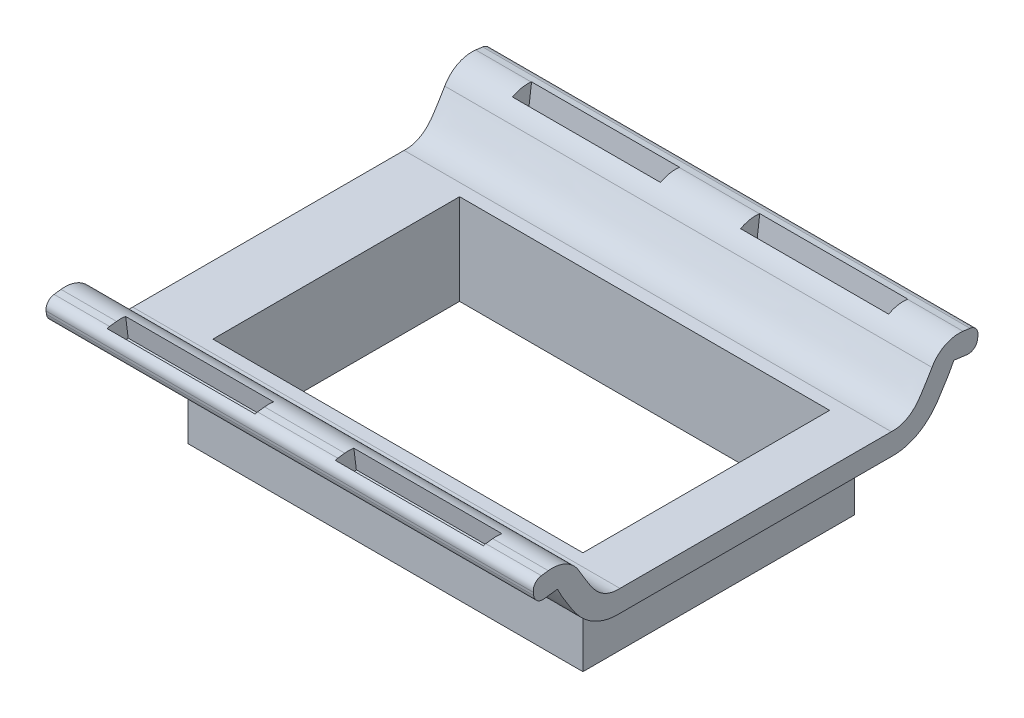
from build123d import *

# Parameters (mm, degrees)
BOSS_EXTRUDE1_DEPTH      = 6
BOSS_EXTRUDE1_DEPTH_BACK = 73
SKETCH1_W                = 60
SKETCH1_H                = 40
CUT_EXTRUDE2_DEPTH       = 10
SKETCH7_W                = 64
SKETCH7_H                = 44
SKETCH7_W_2              = 60
SKETCH7_H_2              = 40
BOSS_EXTRUDE2_DEPTH      = 11.2
SKETCH5_W                = 24
SKETCH5_H                = 3
CUT_EXTRUDE3_DEPTH       = 11.2
SKETCH8_W                = 24
SKETCH8_H                = 3
CUT_EXTRUDE4_DEPTH       = 11.2
FILLET1_R                = 5


with BuildPart() as part:
    # Sketch2 → Boss-Extrude1 (new, two sides: drawn at the far end of the back side and taken through both)
    with BuildSketch(Plane(origin=(18.941176471, 0, 0), x_dir=(0, 0, -1), z_dir=(1, 0, 0)).offset(-BOSS_EXTRUDE1_DEPTH_BACK)):
        with BuildLine():
            Line((34.764705882, 0), (-9.235294118, 0))
            add(Edge.make_bspline(
                [(-16.859042356, 8.803732274), (-16.71202536, 7.645123783), (-16.476121405, 6.983025742), (-15.665438552, 5.367344471), (-15.146819104, 4.569071681), (-14.219232142, 3.103782941), (-13.097173401, 1.202110064), (-10.958273151, -0.0861532), (-9.235294118, 0)],
                knots=[0.100936793, 0.100936793, 0.100936793, 0.100936793, 0.214701658, 0.247771225, 0.411203439, 0.4591999, 0.679739374, 1, 1, 1, 1], degree=3))
            Line((-16.859042356, 8.803732274), (-20.331201871, 8.363155033))
            Line((-20.331201871, 8.363155033), (-21.979605491, 8.153991509))
            ThreePointArc((-21.979605491, 8.153991509), (-22.976524971, 7.58463131), (-23.278855037, 6.477104328))
            Line((-23.278855037, 6.477104328), (-23.215915431, 5.981081541))
            ThreePointArc((-23.215915431, 5.981081541), (-22.646555232, 4.984162061), (-21.53902825, 4.681831995))
            Line((-21.53902825, 4.681831995), (-19.89062463, 4.890995519))
            Line((-19.89062463, 4.890995519), (-19.371936566, 4.956811088))
            add(Edge.make_bspline(
                [(-19.371936566, 4.956811088), (-19.299083809, 4.805602772), (-19.143543885, 4.495535048), (-18.861030136, 3.961180263), (-18.379944727, 3.117280646), (-17.808764188, 2.238291872), (-17.267901922, 1.360604939), (-16.505554516, 0.170581495), (-15.372861084, -1.167927692), (-13.787032793, -2.419221644), (-12.034516859, -3.186353681), (-10.648338067, -3.44710609), (-10.029136817, -3.492321417), (-9.829873201, -3.5)],
                knots=[0.220066507, 0.220066507, 0.220066507, 0.220066507, 0.244323833, 0.26858116, 0.317095812, 0.414125118, 0.511154423, 0.608183729, 0.705213035, 0.80224234, 0.899271646, 0.947786298, 0.970646745, 0.970646745, 0.970646745, 0.970646745], degree=3))
            Line((-9.829873201, -3.5), (-9.158730941, -3.5))
            Line((-9.158730941, -3.5), (34.688142706, -3.5))
            Line((34.688142706, -3.5), (35.359284966, -3.5))
            add(Edge.make_bspline(
                [(35.359284966, -3.5), (35.558548581, -3.492321417), (36.177749832, -3.44710609), (37.563928624, -3.186353681), (39.316444558, -2.419221644), (40.902272849, -1.167927692), (42.034966281, 0.170581495), (42.797313687, 1.360604939), (43.338175952, 2.238291872), (43.909356491, 3.117280646), (44.390441901, 3.961180263), (44.67295565, 4.495535048), (44.828495573, 4.805602772), (44.901348331, 4.956811088)],
                knots=[0.245720713, 0.245720713, 0.245720713, 0.245720713, 0.26858116, 0.317095812, 0.414125118, 0.511154423, 0.608183729, 0.705213035, 0.80224234, 0.899271646, 0.947786298, 0.972043625, 0.996300951, 0.996300951, 0.996300951, 0.996300951], degree=3))
            Line((44.901348331, 4.956811088), (45.420036395, 4.890995519))
            Line((45.420036395, 4.890995519), (47.068440015, 4.681831995))
            ThreePointArc((47.068440015, 4.681831995), (48.175966997, 4.984162061), (48.745327196, 5.981081541))
            Line((48.745327196, 5.981081541), (48.808266802, 6.477104328))
            ThreePointArc((48.808266802, 6.477104328), (48.505936735, 7.58463131), (47.509017256, 8.153991509))
            Line((47.509017256, 8.153991509), (45.860613636, 8.363155033))
            Line((45.860613636, 8.363155033), (42.388454121, 8.803732274))
            add(Edge.make_bspline(
                [(42.388454121, 8.803732274), (42.241437125, 7.645123783), (42.00553317, 6.983025742), (41.194850317, 5.367344471), (40.676230869, 4.569071681), (39.748643907, 3.103782941), (38.626585166, 1.202110064), (36.487684916, -0.0861532), (34.764705882, 0)],
                knots=[0.100936793, 0.100936793, 0.100936793, 0.100936793, 0.214701658, 0.247771225, 0.411203439, 0.4591999, 0.679739374, 1, 1, 1, 1], degree=3))
        make_face()
    extrude(amount=BOSS_EXTRUDE1_DEPTH + BOSS_EXTRUDE1_DEPTH_BACK)

    # Sketch1 → Cut-Extrude2 (cut)
    with BuildSketch(Plane(origin=(0, 0, 0), x_dir=(1, 0, 0), z_dir=(0, 1, 0))):
        with Locations((-13.058823529, 12.764705882)):
            Rectangle(SKETCH1_W, SKETCH1_H)
    extrude(amount=-CUT_EXTRUDE2_DEPTH, mode=Mode.SUBTRACT)

    # Sketch7 → Boss-Extrude2 (add)
    with BuildSketch(Plane.XZ.offset(3.5)):
        with Locations((-13.058823529, -12.764705882)):
            Rectangle(SKETCH7_W, SKETCH7_H)
        with Locations((-13.058823529, -12.764705882)):
            Rectangle(SKETCH7_W_2, SKETCH7_H_2, mode=Mode.SUBTRACT)
    extrude(amount=BOSS_EXTRUDE2_DEPTH)

    # Sketch5 → Cut-Extrude3 (cut)
    with BuildSketch(Plane(origin=(0, 7.29739461, 0.925955726), x_dir=(1, 0, 0), z_dir=(0, -0.9920455755956746, -0.12587921171125438))):
        with Locations((-33.058823529, 19.686118423)):
            Rectangle(SKETCH5_W, SKETCH5_H)
        with Locations((3.941176471, 19.686118423)):
            Rectangle(SKETCH5_W, SKETCH5_H)
    extrude(amount=-CUT_EXTRUDE3_DEPTH, mode=Mode.SUBTRACT)

    # Sketch8 → Cut-Extrude4 (cut)
    with BuildSketch(Plane(origin=(0, 13.957613838, -1.7710612), x_dir=(1, 0, 0), z_dir=(0, 0.9920455755956736, -0.12587921171126285))):
        with Locations((-33.058823529, 43.523881917)):
            Rectangle(SKETCH8_W, SKETCH8_H)
        with Locations((3.941176471, 43.523881917)):
            Rectangle(SKETCH8_W, SKETCH8_H)
    extrude(amount=-CUT_EXTRUDE4_DEPTH, mode=Mode.SUBTRACT)

    # Fillet1
    # the kernel refuses this fillet: 5 mm, written as the material it takes off along each edge
    with BuildSketch(Plane(origin=(18.941176471, 8.803732274, -42.388454121), x_dir=(0, -0.12587921171125008, -0.9920455755956751), z_dir=(-1, 0, 0))) as fillet1_piece_1:
        with BuildLine():
            CenterArc((4.027488586, 5), FILLET1_R, 201.320916369, 68.679083631)
            Line((-0.6303042, 3.182043355), (-0.723460056, 3.145684222))
            ThreePointArc((-0.723460056, 3.145684222), (-0.228216041, 1.608856089), (-0.1, -2.43e-07))
            Line((-0.1, -2.43e-07), (0, -0.1))
            Line((0, -0.1), (4.027488586, -0.1))
            Line((4.027488586, -0.1), (4.027488586, 0))
        make_face()
    extrude(amount=83.068721464, mode=Mode.SUBTRACT)
    with BuildSketch(Plane(origin=(18.941176471, 8.803732274, 16.859042356), x_dir=(0, -0.12587921171124858, 0.9920455755956752), z_dir=(-1, 0, 0))) as fillet1_piece_2:
        with BuildLine():
            CenterArc((4.027488586, -5), FILLET1_R, 90, 68.679083631)
            Line((-0.6303042, -3.182043355), (-0.723460056, -3.145684222))
            ThreePointArc((-0.723460056, -3.145684222), (-0.228216041, -1.608856089), (-0.1, 2.43e-07))
            Line((-0.1, 2.43e-07), (0, 0.1))
            Line((0, 0.1), (4.027488586, 0.1))
            Line((4.027488586, 0.1), (4.027488586, 0))
        make_face()
    extrude(amount=83.068721464, mode=Mode.SUBTRACT)
    with BuildSketch(Plane(origin=(18.941176471, 8.803732274, 16.859042356), x_dir=(0, -0.948678952181438, -0.31624080332545423), z_dir=(1, 0, 0))) as fillet1_piece_3:
        with BuildLine():
            CenterArc((4.12213797, -4.922259934), FILLET1_R, 100.116712127, 68.679083631)
            Line((-0.782566531, -3.950728279), (-0.880660621, -3.931297646))
            Line((-0.880660621, -3.931297646), (-0.09809409, 0.019430633))
            Line((-0.09809409, 0.019430633), (0.019430395, 0.098094137))
            ThreePointArc((0.019430395, 0.098094137), (1.622536562, -0.088744475), (3.226303182, 0.098445199))
            Line((3.226303182, 0.098445199), (3.24386857, 0))
        make_face()
    extrude(amount=16.068721464, mode=Mode.SUBTRACT)
    with BuildSketch(Plane(origin=(18.941176471, 8.803732274, -42.388454121), x_dir=(0, -0.12587921171125008, -0.9920455755956751), z_dir=(1, 0, 0))) as fillet1_piece_4:
        with BuildLine():
            CenterArc((4.027488586, -5), FILLET1_R, 90, 68.679083631)
            Line((-0.6303042, -3.182043355), (-0.723460056, -3.145684222))
            ThreePointArc((-0.723460056, -3.145684222), (-0.228216041, -1.608856089), (-0.1, 2.43e-07))
            Line((-0.1, 2.43e-07), (0, 0.1))
            Line((0, 0.1), (4.027488586, 0.1))
            Line((4.027488586, 0.1), (4.027488586, 0))
        make_face()
    extrude(amount=16.068721464, mode=Mode.SUBTRACT)


solid = part.part
